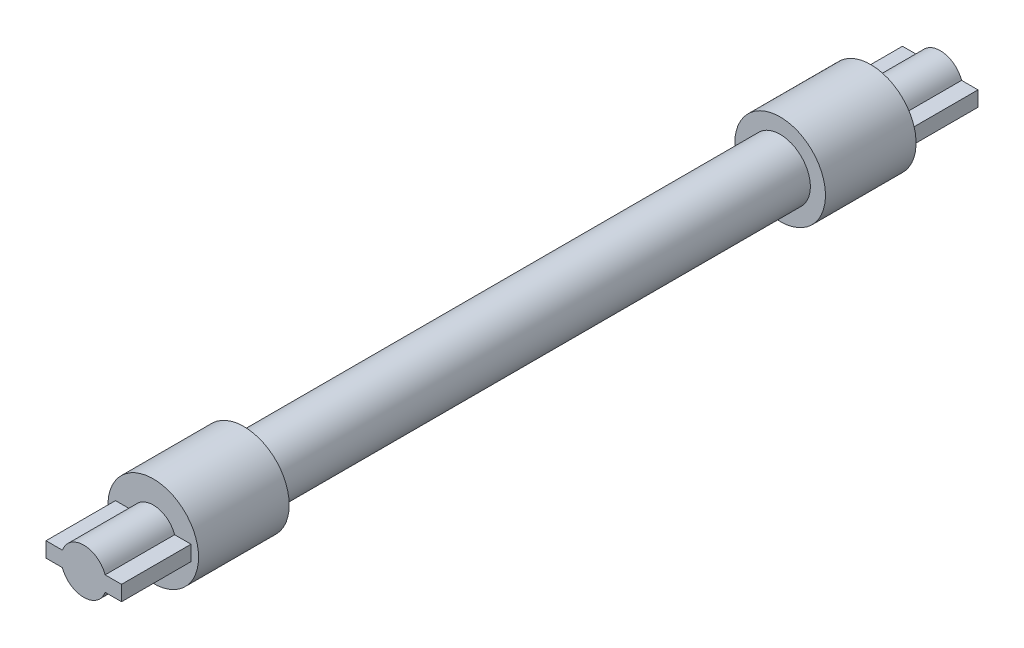
from build123d import *

# Parameters (mm, degrees)
SKETCH1_R           = 40
BOSS_EXTRUDE1_DEPTH = 710
SKETCH2_R           = 60
BOSS_EXTRUDE2_DEPTH = 120
BOSS_EXTRUDE3_START = 120
SKETCH3_R           = 60
BOSS_EXTRUDE3_DEPTH = 120
BOSS_EXTRUDE4_DEPTH = 92
BOSS_EXTRUDE5_START = 92
BOSS_EXTRUDE5_DEPTH = 92


with BuildPart() as part:
    # Sketch1 → Boss-Extrude1 (new body)
    with BuildSketch(Plane.XY):
        Circle(SKETCH1_R)
    extrude(amount=BOSS_EXTRUDE1_DEPTH)

    # Sketch2 → Boss-Extrude2 (add)
    with BuildSketch(Plane.XY.offset(710)):
        Circle(SKETCH2_R)
    extrude(amount=BOSS_EXTRUDE2_DEPTH)

    # Sketch3 → Boss-Extrude3 (add)
    with BuildSketch(Plane(origin=(0, 0, 0), x_dir=(-1, 0, 0), z_dir=(0, 0, -1)).offset(BOSS_EXTRUDE3_START)):
        Circle(SKETCH3_R)
    extrude(amount=-BOSS_EXTRUDE3_DEPTH)

    # Sketch4 → Boss-Extrude4 (add)
    with BuildSketch(Plane.XY.offset(830)):
        with BuildLine():
            Line((-28.284271247, 10), (-50, 10))
            Line((-50, 10), (-50, -10))
            Line((-50, -10), (-28.284271247, -10))
            ThreePointArc((-28.284271247, -10), (0, -30), (28.284271247, -10))
            Line((28.284271247, -10), (50, -10))
            Line((50, -10), (50, 10))
            Line((50, 10), (28.284271247, 10))
            ThreePointArc((28.284271247, 10), (0, 30), (-28.284271247, 10))
        make_face()
    extrude(amount=BOSS_EXTRUDE4_DEPTH)

    # Sketch5 → Boss-Extrude5 (add)
    with BuildSketch(Plane(origin=(0, 0, -120), x_dir=(-1, 0, 0), z_dir=(0, 0, -1)).offset(BOSS_EXTRUDE5_START)):
        with BuildLine():
            Line((28.284271247, -10), (50, -10))
            Line((50, -10), (50, 10))
            Line((50, 10), (28.284271247, 10))
            ThreePointArc((28.284271247, 10), (0, 30), (-28.284271247, 10))
            Line((-28.284271247, 10), (-50, 10))
            Line((-50, 10), (-50, -10))
            Line((-50, -10), (-28.284271247, -10))
            ThreePointArc((-28.284271247, -10), (0, -30), (28.284271247, -10))
        make_face()
    extrude(amount=-BOSS_EXTRUDE5_DEPTH)


solid = part.part
